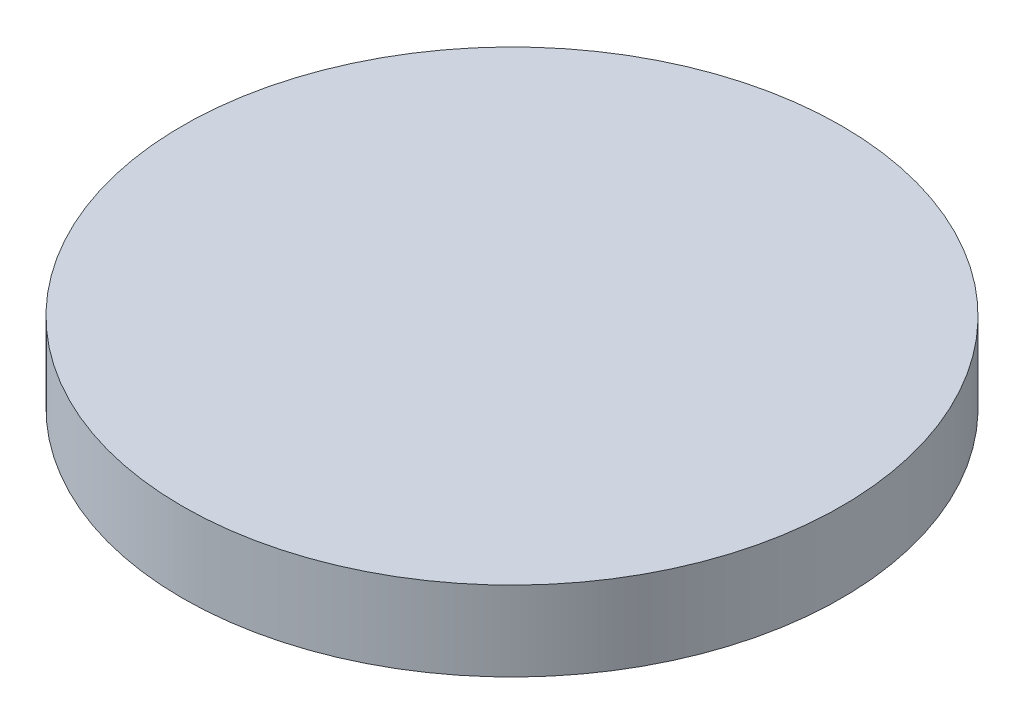
from build123d import *

# Parameters (mm, degrees)
SKETCH1_R           = 8.28
BOSS_EXTRUDE1_DEPTH = 2


with BuildPart() as part:
    # Sketch1 → Boss-Extrude1 (new body)
    with BuildSketch(Plane(origin=(0, 0, 0), x_dir=(1, 0, 0), z_dir=(0, 1, 0))):
        Circle(SKETCH1_R)
    extrude(amount=BOSS_EXTRUDE1_DEPTH)


solid = part.part
